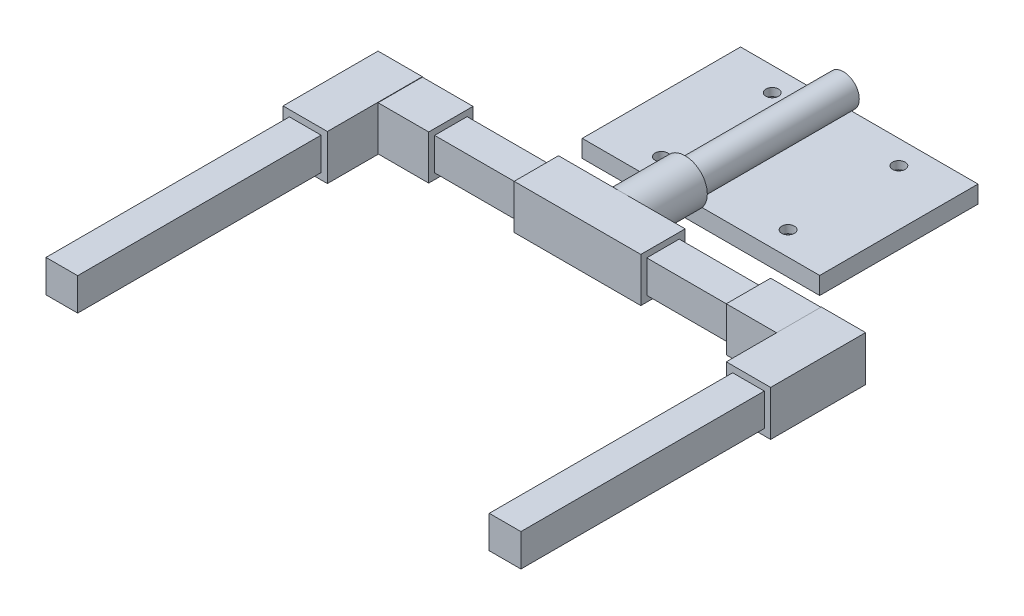
from build123d import *

# Parameters (mm, degrees)
SALIENTE_EXTRUIR1_DEPTH      = 70
SALIENTE_EXTRUIR1_DEPTH_BACK = 70
CROQUIS1_R                   = 10
SALIENTE_EXTRUIR2_START      = 30
CROQUIS2_R                   = 14
CROQUIS2_R_2                 = 10
SALIENTE_EXTRUIR2_DEPTH      = 40
SALIENTE_EXTRUIR3_DEPTH      = 150
SALIENTE_EXTRUIR3_DEPTH_BACK = 150
CROQUIS3_W                   = 20.5
CROQUIS3_H                   = 20.5
SALIENTE_EXTRUIR4_DEPTH      = 40
SALIENTE_EXTRUIR4_DEPTH_BACK = 40
CROQUIS3_3_W                 = 28
CROQUIS3_3_H                 = 28
CROQUIS3_3_W_2               = 20.5
CROQUIS3_3_H_2               = 20.5
SALIENTE_EXTRUIR5_START      = 73.75
CROQUIS4_W                   = 20
CROQUIS4_H                   = 20.5
SALIENTE_EXTRUIR5_DEPTH      = 210
SALIENTE_EXTRUIR5_2_DEPTH    = 210
SALIENTE_EXTRUIR6_START      = 70
CROQUIS4_3_W                 = 28
CROQUIS4_3_H                 = 28.5
CROQUIS4_3_W_2               = 20
CROQUIS4_3_H_2               = 20.5
SALIENTE_EXTRUIR6_DEPTH      = 60
SALIENTE_EXTRUIR6_2_DEPTH    = 60
SALIENTE_EXTRUIR7_START      = -154
CROQUIS3_4_W                 = 28
CROQUIS3_4_H                 = 28
CROQUIS3_4_W_2               = 20.5
CROQUIS3_4_H_2               = 20.5
SALIENTE_EXTRUIR7_DEPTH      = 60
SALIENTE_EXTRUIR8_START      = 154
CROQUIS3_5_W                 = 28
CROQUIS3_5_H                 = 28
CROQUIS3_5_W_2               = 20.5
CROQUIS3_5_H_2               = 20.5
SALIENTE_EXTRUIR8_DEPTH      = 60
SALIENTE_EXTRUIR9_START      = -30
CROQUIS5_W                   = 150
CROQUIS5_H                   = 100
CROQUIS5_R                   = 4
SALIENTE_EXTRUIR9_DEPTH      = 11
INDENTACI_N1_START           = -130
INDENTACI_N1_OUTLINE_W       = 20.5
INDENTACI_N1_OUTLINE_H       = 20.5
INDENTACI_N1_DEPTH           = 4
INDENTACI_N1_START_2         = -150
INDENTACI_N1_2_OUTLINE_W     = 20.5
INDENTACI_N1_2_OUTLINE_H     = 3.75
INDENTACI_N1_2_DEPTH         = 20
CORTAR_EXTRUIR1_START        = -30
CORTAR_EXTRUIR1_DEPTH        = 6


# Read off the part's stored shape, not the designer's step: Indentación1
with BuildPart() as part:
    # Croquis1 → Saliente-Extruir1 (new, two sides: drawn at the far end of the back side and taken through both)
    with BuildSketch(Plane.XY.offset(-SALIENTE_EXTRUIR1_DEPTH_BACK)):
        Circle(CROQUIS1_R)
    extrude(amount=SALIENTE_EXTRUIR1_DEPTH + SALIENTE_EXTRUIR1_DEPTH_BACK)


with BuildPart() as body_2:
    # Croquis2 → Saliente-Extruir2 (new body)
    with BuildSketch(Plane.XY.offset(SALIENTE_EXTRUIR2_START)):
        Circle(CROQUIS2_R)
        Circle(CROQUIS2_R_2, mode=Mode.SUBTRACT)
    extrude(amount=SALIENTE_EXTRUIR2_DEPTH)

    # Croquis3<3> → Saliente-Extruir4 (add, two sides: drawn at the far end of the back side and taken through both)
    with BuildSketch(Plane(origin=(0, 0, 0), x_dir=(0, 0, -1), z_dir=(1, 0, 0)).offset(-SALIENTE_EXTRUIR4_DEPTH_BACK)):
        with Locations((-84, 0)):
            Rectangle(CROQUIS3_3_W, CROQUIS3_3_H)
        with Locations((-84, 0)):
            Rectangle(CROQUIS3_3_W_2, CROQUIS3_3_H_2, mode=Mode.SUBTRACT)
    extrude(amount=SALIENTE_EXTRUIR4_DEPTH + SALIENTE_EXTRUIR4_DEPTH_BACK)


with BuildPart() as body_3:
    # Croquis3 → Saliente-Extruir3 (new, two sides: drawn at the far end of the back side and taken through both)
    with BuildSketch(Plane(origin=(0, 0, 0), x_dir=(0, 0, -1), z_dir=(1, 0, 0)).offset(-SALIENTE_EXTRUIR3_DEPTH_BACK)):
        with Locations((-84, 0)):
            Rectangle(CROQUIS3_W, CROQUIS3_H)
    extrude(amount=SALIENTE_EXTRUIR3_DEPTH + SALIENTE_EXTRUIR3_DEPTH_BACK)


with BuildPart() as body_4:
    # Croquis4 → Saliente-Extruir5 (new body)
    with BuildSketch(Plane.XY.offset(SALIENTE_EXTRUIR5_START)):
        with Locations((-140, 0)):
            Rectangle(CROQUIS4_W, CROQUIS4_H)
    extrude(amount=SALIENTE_EXTRUIR5_DEPTH)


with BuildPart() as body_5:
    # Croquis4 → Saliente-Extruir5 2 (new body)
    with BuildSketch(Plane.XY.offset(SALIENTE_EXTRUIR5_START)):
        with Locations((140, 0)):
            Rectangle(CROQUIS4_W, CROQUIS4_H)
    extrude(amount=SALIENTE_EXTRUIR5_2_DEPTH)


with BuildPart() as body_6:
    # Croquis4<3> → Saliente-Extruir6 (new body)
    with BuildSketch(Plane.XY.offset(SALIENTE_EXTRUIR6_START)):
        with Locations((-140, 0)):
            Rectangle(CROQUIS4_3_W, CROQUIS4_3_H)
        with Locations((-140, 0)):
            Rectangle(CROQUIS4_3_W_2, CROQUIS4_3_H_2, mode=Mode.SUBTRACT)
    extrude(amount=SALIENTE_EXTRUIR6_DEPTH)

    # Croquis3<4> → Saliente-Extruir7 (add)
    with BuildSketch(Plane(origin=(0, 0, 0), x_dir=(0, 0, -1), z_dir=(1, 0, 0)).offset(SALIENTE_EXTRUIR7_START)):
        with Locations((-84, 0)):
            Rectangle(CROQUIS3_4_W, CROQUIS3_4_H)
        with Locations((-84, 0)):
            Rectangle(CROQUIS3_4_W_2, CROQUIS3_4_H_2, mode=Mode.SUBTRACT)
    extrude(amount=SALIENTE_EXTRUIR7_DEPTH)

    # Indentación1 outline → Indentación1 (cut)
    with BuildSketch(Plane.YZ.offset(INDENTACI_N1_START)):
        with Locations((0, 84)):
            Rectangle(INDENTACI_N1_OUTLINE_W, INDENTACI_N1_OUTLINE_H)
    extrude(amount=INDENTACI_N1_DEPTH, mode=Mode.SUBTRACT)

    # Indentaci_n1 2 outline → Indentaci_n1 2 (cut)
    with BuildSketch(Plane.YZ.offset(INDENTACI_N1_START_2)):
        with Locations((0, 96.125)):
            Rectangle(INDENTACI_N1_2_OUTLINE_W, INDENTACI_N1_2_OUTLINE_H)
    extrude(amount=INDENTACI_N1_2_DEPTH, mode=Mode.SUBTRACT)


with BuildPart() as body_7:
    # Croquis4<3> → Saliente-Extruir6 2 (new body)
    with BuildSketch(Plane.XY.offset(SALIENTE_EXTRUIR6_START)):
        with Locations((140, 0)):
            Rectangle(CROQUIS4_3_W, CROQUIS4_3_H)
        with Locations((140, 0)):
            Rectangle(CROQUIS4_3_W_2, CROQUIS4_3_H_2, mode=Mode.SUBTRACT)
    extrude(amount=SALIENTE_EXTRUIR6_2_DEPTH)

    # Croquis3<5> → Saliente-Extruir8 (add)
    with BuildSketch(Plane(origin=(0, 0, 0), x_dir=(0, 0, -1), z_dir=(1, 0, 0)).offset(SALIENTE_EXTRUIR8_START)):
        with Locations((-84, 0)):
            Rectangle(CROQUIS3_5_W, CROQUIS3_5_H)
        with Locations((-84, 0)):
            Rectangle(CROQUIS3_5_W_2, CROQUIS3_5_H_2, mode=Mode.SUBTRACT)
    extrude(amount=-SALIENTE_EXTRUIR8_DEPTH)


with BuildPart() as body_8:
    # Croquis5 → Saliente-Extruir9 (new body)
    with BuildSketch(Plane(origin=(0, 0, 0), x_dir=(1, 0, 0), z_dir=(0, 1, 0)).offset(SALIENTE_EXTRUIR9_START)):
        with Locations((0, 30)):
            Rectangle(CROQUIS5_W, CROQUIS5_H)
        with Locations(Location((40, 65, 0), (0, 0, 270))):
            Circle(CROQUIS5_R, mode=Mode.SUBTRACT)
        with Locations(Location((40, -5, 0), (0, 0, 270))):
            Circle(CROQUIS5_R, mode=Mode.SUBTRACT)
        with Locations(Location((-40, -5, 0), (0, 0, 270))):
            Circle(CROQUIS5_R, mode=Mode.SUBTRACT)
        with Locations(Location((-40, 65, 0), (0, 0, 270))):
            Circle(CROQUIS5_R, mode=Mode.SUBTRACT)
    extrude(amount=SALIENTE_EXTRUIR9_DEPTH)

    # Croquis6 → Cortar-Extruir1 (cut)
    with BuildSketch(Plane(origin=(0, 0, 0), x_dir=(1, 0, 0), z_dir=(0, 1, 0)).offset(CORTAR_EXTRUIR1_START)):
        Polygon((-36.218355737, -11.55), (-32.436711474, -5), (-36.218355737, 1.55), (-43.781644263, 1.55), (-47.563288526, -5), (-43.781644263, -11.55), align=None)
        Polygon((47.563288526, -5), (43.781644263, -11.55), (36.218355737, -11.55), (32.436711474, -5), (36.218355737, 1.55), (43.781644263, 1.55), align=None)
        Polygon((36.218355737, 71.55), (32.436711474, 65), (36.218355737, 58.45), (43.781644263, 58.45), (47.563288526, 65), (43.781644263, 71.55), align=None)
        Polygon((-47.563288526, 65), (-43.781644263, 71.55), (-36.218355737, 71.55), (-32.436711474, 65), (-36.218355737, 58.45), (-43.781644263, 58.45), align=None)
    extrude(amount=CORTAR_EXTRUIR1_DEPTH, mode=Mode.SUBTRACT)


solid = Compound([part.part, body_2.part, body_3.part, body_4.part, body_5.part, body_6.part, body_7.part, body_8.part])
